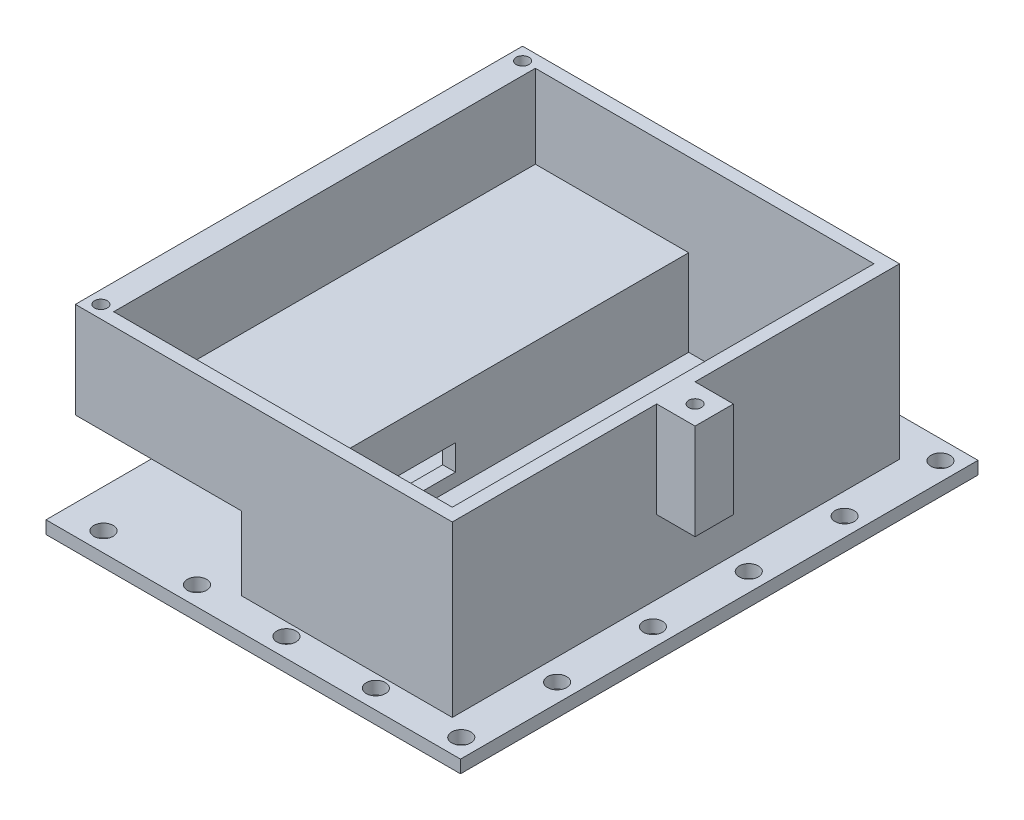
from build123d import *

# Parameters (mm, degrees)
BOSS_EXTRU_1_DEPTH                  = 70
ESQUISSE2_W                         = 64.879929842
ESQUISSE2_H                         = 80.999999972
ESQUISSE2_R                         = 1.499999992
ESQUISSE2_R_2                       = 1.499999996
ESQUISSE2_R_3                       = 1.499999991
ESQUISSE2_R_4                       = 1.499999993
ESQUISSE2_R_5                       = 1.499999999
ESQUISSE2_R_6                       = 1.5
BOSS_EXTRU_2_DEPTH                  = 2
COQUE1_START                        = 19.900521193
COQUE1_OUTLINE_W                    = 29
COQUE1_OUTLINE_H                    = 66
COQUE1_DEPTH                        = 26.5
COQUE1_START_2                      = 33.400521193
COQUE1_2_OUTLINE_W                  = 24
COQUE1_2_OUTLINE_H                  = 66
COQUE1_2_DEPTH                      = 13
ENL_V_MAT_EXTRU_1_REACH             = 98.547
ESQUISSE4_W                         = 10
ESQUISSE4_H                         = 4
ENL_V_MAT_EXTRU_2_REACH             = 98.547
ESQUISSE5_W                         = 10
ESQUISSE5_H                         = 4
ESQUISSE8_W                         = 70
ESQUISSE8_H                         = 15
BOSS_EXTRU_4_DEPTH                  = 2
ENL_V_MAT_EXTRU_4_REACH             = 128.81
ESQUISSE9_R                         = 1
ENL_V_MAT_EXTRU_4_DIRECTION_2_DEPTH = 127.809653192
ESQUISSE10_W                        = 6
ESQUISSE10_H                        = 15
BOSS_EXTRU_5_DEPTH                  = 6
ESQUISSE11_R                        = 1
ENL_V_MAT_EXTRU_5_DEPTH             = 21


# Read off the part's stored shape, not the designer's step: Coque1
with BuildPart() as part:
    # Esquisse1 → Boss.-Extru.1 (new body)
    with BuildSketch(Plane.XY):
        Polygon((-96.201008889, 46.400521193), (-39.201008889, 46.400521193), (-39.201008889, 19.900521193), (-72.201008889, 19.900521193), (-72.201008889, 31.400521193), (-96.201008889, 31.400521193), align=None)
    extrude(amount=BOSS_EXTRU_1_DEPTH)

    # Esquisse2 → Boss.-Extru.2 (add)
    with BuildSketch(Plane(origin=(0, 19.900521193, 0), x_dir=(-1, 0, 0), z_dir=(0, -1, 0))):
        with Locations((65.355645606, -34.499999986)):
            Rectangle(ESQUISSE2_W, ESQUISSE2_H)
        with Locations(Location((35.797436273, -71.999999972, 0), (0, 0, 180))):
            Circle(ESQUISSE2_R, mode=Mode.SUBTRACT)
        with Locations(Location((35.797290063, -56.999999973, 0), (0, 0, 180))):
            Circle(ESQUISSE2_R_2, mode=Mode.SUBTRACT)
        with Locations(Location((35.797008085, -41.999999976, 0), (0, 0, 180))):
            Circle(ESQUISSE2_R_3, mode=Mode.SUBTRACT)
        with Locations(Location((35.796726108, -26.999999979, 0), (0, 0, 180))):
            Circle(ESQUISSE2_R_4, mode=Mode.SUBTRACT)
        with Locations(Location((35.796274405, -11.999999985, 0), (0, 0, 180))):
            Circle(ESQUISSE2_R_5, mode=Mode.SUBTRACT)
        with Locations(Location((35.795610527, 3, 0), (0, 0, 180))):
            Circle(ESQUISSE2_R_6, mode=Mode.SUBTRACT)
        with Locations(Location((49.795610527, 3, 0), (0, 0, 180))):
            Circle(ESQUISSE2_R_6, mode=Mode.SUBTRACT)
        with Locations(Location((63.795610527, 3, 0), (0, 0, 180))):
            Circle(ESQUISSE2_R_6, mode=Mode.SUBTRACT)
        with Locations(Location((77.795610527, 3, 0), (0, 0, 180))):
            Circle(ESQUISSE2_R_6, mode=Mode.SUBTRACT)
        with Locations(Location((91.795610527, 3, 0), (0, 0, 180))):
            Circle(ESQUISSE2_R_6, mode=Mode.SUBTRACT)
        with Locations(Location((91.795610527, -12, 0), (0, 0, 180))):
            Circle(ESQUISSE2_R_6, mode=Mode.SUBTRACT)
        with Locations(Location((91.795610527, -27, 0), (0, 0, 180))):
            Circle(ESQUISSE2_R_6, mode=Mode.SUBTRACT)
        with Locations(Location((91.795610527, -42, 0), (0, 0, 180))):
            Circle(ESQUISSE2_R_6, mode=Mode.SUBTRACT)
        with Locations(Location((91.795610527, -57, 0), (0, 0, 180))):
            Circle(ESQUISSE2_R_6, mode=Mode.SUBTRACT)
        with Locations(Location((91.795610527, -72, 0), (0, 0, 180))):
            Circle(ESQUISSE2_R_6, mode=Mode.SUBTRACT)
        with Locations(Location((49.163080617, -71.999999972, 0), (0, 0, 180))):
            Circle(ESQUISSE2_R, mode=Mode.SUBTRACT)
        with Locations(Location((63.163080617, -71.999999972, 0), (0, 0, 180))):
            Circle(ESQUISSE2_R, mode=Mode.SUBTRACT)
        with Locations(Location((77.163080617, -71.999999972, 0), (0, 0, 180))):
            Circle(ESQUISSE2_R, mode=Mode.SUBTRACT)
    extrude(amount=BOSS_EXTRU_2_DEPTH)

    # Coque1 outline → Coque1 (cut)
    with BuildSketch(Plane(origin=(0, 0, 0), x_dir=(1, 0, 0), z_dir=(0, 1, 0)).offset(COQUE1_START)):
        with Locations((-55.701008889, -35)):
            Rectangle(COQUE1_OUTLINE_W, COQUE1_OUTLINE_H)
    extrude(amount=COQUE1_DEPTH, mode=Mode.SUBTRACT)

    # Coque1 2 outline → Coque1 2 (cut)
    with BuildSketch(Plane(origin=(0, 0, 0), x_dir=(1, 0, 0), z_dir=(0, 1, 0)).offset(COQUE1_START_2)):
        with Locations((-82.201008889, -35)):
            Rectangle(COQUE1_2_OUTLINE_W, COQUE1_2_OUTLINE_H)
    extrude(amount=COQUE1_2_DEPTH, mode=Mode.SUBTRACT)

    # Esquisse4 → Enlèv. mat.-Extru.1 (cut, up to next)
    with BuildSketch(Plane.ZY.offset(72.201008889), mode=Mode.PRIVATE) as enl_v_mat_extru_1_sk1:
        with Locations((57.5, 23.900521193)):
            Rectangle(ESQUISSE4_W, ESQUISSE4_H)
    enl_v_mat_extru_1_tool1 = extrude(enl_v_mat_extru_1_sk1.sketch, amount=-ENL_V_MAT_EXTRU_1_REACH, mode=Mode.PRIVATE) & part.part
    add(enl_v_mat_extru_1_tool1.solids().sort_by_distance((-72.201009, 23.900521, 57.5))[0], mode=Mode.SUBTRACT)

    # Esquisse5 → Enlèv. mat.-Extru.2 (cut, up to next)
    with BuildSketch(Plane.ZY.offset(72.201008889), mode=Mode.PRIVATE) as enl_v_mat_extru_2_sk1:
        with Locations((43.5, 23.900521193)):
            Rectangle(ESQUISSE5_W, ESQUISSE5_H)
    enl_v_mat_extru_2_tool1 = extrude(enl_v_mat_extru_2_sk1.sketch, amount=-ENL_V_MAT_EXTRU_2_REACH, mode=Mode.PRIVATE) & part.part
    add(enl_v_mat_extru_2_tool1.solids().sort_by_distance((-72.201009, 23.900521, 43.5))[0], mode=Mode.SUBTRACT)

    # Esquisse8 → Boss.-Extru.4 (add)
    with BuildSketch(Plane.ZY.offset(96.201008889)):
        with Locations((35, 38.900521193)):
            Rectangle(ESQUISSE8_W, ESQUISSE8_H)
    extrude(amount=BOSS_EXTRU_4_DEPTH)

    # Esquisse9 → Enlèv. mat.-Extru.4 (cut, up to next)
    with BuildSketch(Plane(origin=(0, 46.400521193, 0), x_dir=(1, 0, 0), z_dir=(0, 1, 0)), mode=Mode.PRIVATE) as enl_v_mat_extru_4_sk1:
        with Locations(Location((-96.201008889, -2, 0), (0, 0, 90))):
            Circle(ESQUISSE9_R)
    enl_v_mat_extru_4_tool1 = extrude(enl_v_mat_extru_4_sk1.sketch, amount=-ENL_V_MAT_EXTRU_4_REACH, mode=Mode.PRIVATE) & part.part
    # Esquisse9 → Enlèv. mat.-Extru.4 (cut, up to next)
    with BuildSketch(Plane(origin=(0, 46.400521193, 0), x_dir=(1, 0, 0), z_dir=(0, 1, 0)), mode=Mode.PRIVATE) as enl_v_mat_extru_4_sk2:
        with Locations(Location((-96.201008889, -68, 0), (0, 0, 90))):
            Circle(ESQUISSE9_R)
    enl_v_mat_extru_4_tool2 = extrude(enl_v_mat_extru_4_sk2.sketch, amount=-ENL_V_MAT_EXTRU_4_REACH, mode=Mode.PRIVATE) & part.part
    add(enl_v_mat_extru_4_tool1.solids().sort_by_distance((-96.201009, 46.400521, 2))[0], mode=Mode.SUBTRACT)
    add(enl_v_mat_extru_4_tool2.solids().sort_by_distance((-96.201009, 46.400521, 68))[0], mode=Mode.SUBTRACT)

    # Esquisse9 → Enlèv. mat.-Extru.4 direction 2 (cut)
    with BuildSketch(Plane(origin=(0, 46.400521193, 0), x_dir=(1, 0, 0), z_dir=(0, 1, 0))):
        with Locations(Location((-96.201008889, -2, 0), (0, 0, 90))):
            Circle(ESQUISSE9_R)
        with Locations(Location((-96.201008889, -68, 0), (0, 0, 90))):
            Circle(ESQUISSE9_R)
    extrude(amount=ENL_V_MAT_EXTRU_4_DIRECTION_2_DEPTH, mode=Mode.SUBTRACT)

    # Esquisse10 → Boss.-Extru.5 (add)
    with BuildSketch(Plane(origin=(-39.201008889, 0, 0), x_dir=(0, 0, -1), z_dir=(1, 0, 0))):
        with Locations((-35, 38.900521193)):
            Rectangle(ESQUISSE10_W, ESQUISSE10_H)
    extrude(amount=BOSS_EXTRU_5_DEPTH)

    # Esquisse11 → Enlèv. mat.-Extru.5 (cut)
    with BuildSketch(Plane(origin=(0, 46.400521193, 0), x_dir=(1, 0, 0), z_dir=(0, 1, 0))):
        with Locations(Location((-36.201008889, -35, 0), (0, 0, 270))):
            Circle(ESQUISSE11_R)
    extrude(amount=-ENL_V_MAT_EXTRU_5_DEPTH, mode=Mode.SUBTRACT)


solid = part.part
